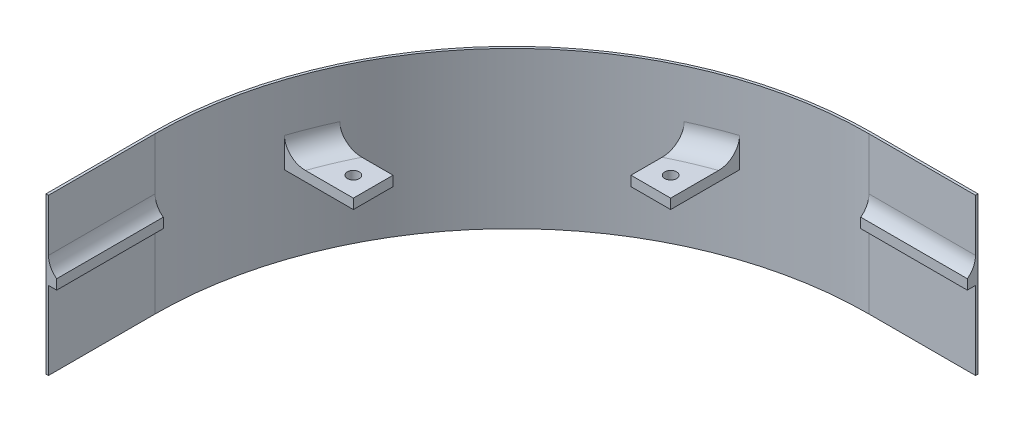
from build123d import *

# Parameters (mm, degrees)
BOSS_EXTRUDE1_DEPTH      = 6.35
CUT_EXTRUDE1_DEPTH       = 6.35
M4_CLEARANCE_HOLE1_D     = 4.5
F_6_CLEARANCE_HOLE1_D    = 3.7973
F_6_CLEARANCE_HOLE2_D    = 3.7973
SKETCH29_R               = 1.898650000000008
BOSS_EXTRUDE4_DEPTH      = 3.175
CUT_EXTRUDE9_DEPTH       = 211.00951038732748
BOSS_EXTRUDE5_DEPTH      = 25
BOSS_EXTRUDE5_DEPTH_BACK = 25
BOSS_EXTRUDE6_DEPTH      = 3.420518063
SKETCH32_W               = 34.13124999999999
SKETCH32_H               = 3.175
BOSS_EXTRUDE7_DEPTH      = 3.420518063
FILLET2_R                = 6.35
FILLET3_R                = 6.35


with BuildPart() as part:
    # Sketch1 → Boss-Extrude1 (new body)
    with BuildSketch(Plane(origin=(0, 0, 0), x_dir=(1, 0, 0), z_dir=(0, 1, 0))):
        with BuildLine():
            Line((-34.13124999999996, -148.43124999999998), (34.131250000000016, -148.43124999999998))
            ThreePointArc((34.131250000000016, -148.43124999999998), (114.9535550896224, -114.95355508962234), (148.43124999999998, -34.13124999999996))
            Line((148.43124999999998, -34.13124999999996), (148.43124999999998, 34.131250000000016))
            ThreePointArc((148.43124999999998, 34.131250000000016), (114.9535550896224, 114.9535550896224), (34.131250000000016, 148.43125000000003))
            Line((34.131250000000016, 148.43125000000003), (-34.13124999999996, 148.43125000000003))
            ThreePointArc((-34.13124999999996, 148.43125000000003), (-114.95355508962231, 114.95355508962237), (-148.43124999999992, 34.131250000000016))
            Line((-148.43124999999992, 34.131250000000016), (-148.43124999999992, -34.13124999999996))
            ThreePointArc((-148.43124999999992, -34.13124999999996), (-114.95355508962234, -114.95355508962234), (-34.13124999999996, -148.43124999999998))
        make_face()
    extrude(amount=BOSS_EXTRUDE1_DEPTH)

    # Sketch4 → Cut-Extrude1 (cut)
    # profile 1 of 4: a face of its own
    with BuildSketch(Plane(origin=(0, 6.35, 0), x_dir=(1, 0, 0), z_dir=(0, 1, 0))):
        with BuildLine():
            ThreePointArc((-39.4480000000008, 145.80448193711538), (-49.893930566331434, 144.3300216659586), (-59.52363351317686, 140.0218527227403))
            ThreePointArc((-59.52363351317686, 140.0218527227403), (-63.81750000000949, 132.2535819370977), (-59.52363351317676, 124.48531115145514))
            ThreePointArc((-59.52363351317676, 124.48531115145514), (-49.89393056632884, 120.17714220824536), (-39.448000000000604, 118.70268193708908))
            Line((-39.448000000000604, 118.70268193708908), (39.44799999999939, 118.70268193708088))
            ThreePointArc((39.44799999999939, 118.70268193708088), (49.89393056633003, 120.17714220823765), (59.52363351317546, 124.48531115145597))
            ThreePointArc((59.52363351317546, 124.48531115145597), (63.817500000008096, 132.25358193709857), (59.523633513170694, 140.0218527227337))
            ThreePointArc((59.523633513170694, 140.0218527227337), (49.893930566325004, 144.3300216659425), (39.4479999999992, 145.80448193710717))
            Line((39.4479999999992, 145.80448193710717), (-39.4480000000008, 145.80448193711538))
        make_face()
        with BuildLine():
            ThreePointArc((39.447999999999375, 120.29018193708089), (49.454528647108134, 121.70261990502122), (58.67916380898574, 125.82956825808905))
            ThreePointArc((58.67916380898574, 125.82956825808905), (62.229999999999336, 132.25358193709857), (58.67916380898565, 138.67759561610805))
            ThreePointArc((58.67916380898565, 138.67759561610805), (49.45452864710313, 142.80454396915894), (39.447999999999205, 144.21698193711595))
            Line((39.447999999999205, 144.21698193711595), (-39.44800000000079, 144.21698193711538))
            ThreePointArc((-39.44800000000079, 144.21698193711538), (-49.454528647109534, 142.80454396917506), (-58.67916380898715, 138.67759561610723))
            ThreePointArc((-58.67916380898715, 138.67759561610723), (-62.23000000000073, 132.25358193709772), (-58.67916380898706, 125.82956825808822))
            ThreePointArc((-58.67916380898706, 125.82956825808822), (-49.454528647104546, 121.70261990503734), (-39.44800000000062, 120.29018193708033))
            Line((-39.44800000000062, 120.29018193708033), (39.447999999999375, 120.29018193708089))
        make_face(mode=Mode.SUBTRACT)
    # profile 2 of 4: a face of its own
    with BuildSketch(Plane(origin=(0, 6.35, 0), x_dir=(1, 0, 0), z_dir=(0, 1, 0))):
        with BuildLine():
            Line((-39.44800000000062, 120.29018193708033), (39.447999999999375, 120.29018193708089))
            ThreePointArc((39.447999999999375, 120.29018193708089), (49.454528647108134, 121.70261990502122), (58.67916380898574, 125.82956825808905))
            ThreePointArc((58.67916380898574, 125.82956825808905), (62.229999999999336, 132.25358193709857), (58.67916380898565, 138.67759561610805))
            ThreePointArc((58.67916380898565, 138.67759561610805), (49.45452864710313, 142.80454396915894), (39.447999999999205, 144.21698193711595))
            Line((39.447999999999205, 144.21698193711595), (-39.44800000000079, 144.21698193711538))
            ThreePointArc((-39.44800000000079, 144.21698193711538), (-49.454528647109534, 142.80454396917506), (-58.67916380898715, 138.67759561610723))
            ThreePointArc((-58.67916380898715, 138.67759561610723), (-62.23000000000073, 132.25358193709772), (-58.67916380898706, 125.82956825808822))
            ThreePointArc((-58.67916380898706, 125.82956825808822), (-49.454528647104546, 121.70261990503734), (-39.44800000000062, 120.29018193708033))
        make_face()
    # profile 3 of 4: a face of its own
    with BuildSketch(Plane(origin=(0, 6.35, 0), x_dir=(1, 0, 0), z_dir=(0, 1, 0))):
        with BuildLine():
            ThreePointArc((-59.5236335131764, -124.48531115145636), (-63.8175000000091, -132.25358193709894), (-59.52363351317174, -140.02185272273414))
            ThreePointArc((-59.52363351317174, -140.02185272273414), (-49.893930566326084, -144.33002166594298), (-39.44800000000029, -145.80448193711646))
            Line((-39.44800000000029, -145.80448193711646), (39.44799999999971, -145.80448193711646))
            ThreePointArc((39.44799999999971, -145.80448193711646), (49.89393056633035, -144.33002166595978), (59.52363351317579, -140.02185272274153))
            ThreePointArc((59.52363351317579, -140.02185272274153), (63.8175000000085, -132.25358193709894), (59.52363351317116, -124.48531115146376))
            ThreePointArc((59.52363351317116, -124.48531115146376), (49.89393056632551, -120.1771422082549), (39.44799999999971, -118.70268193709018))
            Line((39.44799999999971, -118.70268193709018), (-39.44800000000029, -118.70268193708142))
            ThreePointArc((-39.44800000000029, -118.70268193708142), (-49.89393056633094, -120.17714220823811), (-59.5236335131764, -124.48531115145636))
        make_face()
        with BuildLine():
            ThreePointArc((-58.679163808986694, -138.67759561610845), (-49.454528647104205, -142.8045439691594), (-39.44800000000029, -144.21698193711646))
            Line((-39.44800000000029, -144.21698193711646), (39.44799999999971, -144.21698193711646))
            ThreePointArc((39.44799999999971, -144.21698193711646), (49.45452864710846, -142.8045439691762), (58.679163808986104, -138.67759561610845))
            ThreePointArc((58.679163808986104, -138.67759561610845), (62.22999999999976, -132.25358193709894), (58.679163808986104, -125.82956825808944))
            ThreePointArc((58.679163808986104, -125.82956825808944), (49.45452864710362, -121.7026199050385), (39.44799999999971, -120.29018193708143))
            Line((39.44799999999971, -120.29018193708143), (-39.44800000000029, -120.29018193708143))
            ThreePointArc((-39.44800000000029, -120.29018193708143), (-49.45452864710904, -121.70261990502169), (-58.679163808986694, -125.82956825808944))
            ThreePointArc((-58.679163808986694, -125.82956825808944), (-62.230000000000345, -132.25358193709894), (-58.679163808986694, -138.67759561610845))
        make_face(mode=Mode.SUBTRACT)
    # profile 4 of 4: a face of its own
    with BuildSketch(Plane(origin=(0, 6.35, 0), x_dir=(1, 0, 0), z_dir=(0, 1, 0))):
        with BuildLine():
            ThreePointArc((-58.679163808986694, -125.82956825808944), (-62.230000000000345, -132.25358193709894), (-58.679163808986694, -138.67759561610845))
            ThreePointArc((-58.679163808986694, -138.67759561610845), (-49.454528647104205, -142.8045439691594), (-39.44800000000029, -144.21698193711646))
            Line((-39.44800000000029, -144.21698193711646), (39.44799999999971, -144.21698193711646))
            ThreePointArc((39.44799999999971, -144.21698193711646), (49.45452864710846, -142.8045439691762), (58.679163808986104, -138.67759561610845))
            ThreePointArc((58.679163808986104, -138.67759561610845), (62.22999999999976, -132.25358193709894), (58.679163808986104, -125.82956825808944))
            ThreePointArc((58.679163808986104, -125.82956825808944), (49.45452864710362, -121.7026199050385), (39.44799999999971, -120.29018193708143))
            Line((39.44799999999971, -120.29018193708143), (-39.44800000000029, -120.29018193708143))
            ThreePointArc((-39.44800000000029, -120.29018193708143), (-49.45452864710904, -121.70261990502169), (-58.679163808986694, -125.82956825808944))
        make_face()
    extrude(amount=-CUT_EXTRUDE1_DEPTH, mode=Mode.SUBTRACT)

    # M4 Clearance Hole1 (through all)
    with Locations(Plane(origin=(0, 6.35, 0), x_dir=(1, 0, 0), z_dir=(0, 1, 0))):
        with Locations((-16, -103.6875), (16, -103.6875), (22, -60.325), (-10, -60.325), (-10, 60.325), (22, 60.325), (16, 103.6875), (-16, 103.6875)):
            Hole(M4_CLEARANCE_HOLE1_D / 2)

    # #6 Clearance Hole1 (through all)
    with Locations(Plane(origin=(0, 6.35, 0), x_dir=(1, 0, 0), z_dir=(0, 1, 0))):
        with Locations((-101.6, -101.6), (-101.6, 101.6), (101.6, 101.6), (101.6, -101.6), (-127, -76.2), (-127, -50.8), (-127, 50.8), (-127, 76.2), (-101.6, 76.2), (-101.6, 50.8), (-101.6, 25.4), (-101.6, 0), (-101.6, -25.4), (-101.6, -50.8), (-101.6, -76.2), (-76.2, -101.6), (-50.8, -101.6), (-50.8, -76.2), (-76.2, -76.2), (-76.2, -50.8), (-50.8, -50.8), (-50.8, -25.4), (-76.2, -25.4), (-76.2, 0), (-50.8, 0), (-50.8, 25.4), (-76.2, 25.4), (-76.2, 50.8), (-50.8, 50.8), (-50.8, 76.2), (-76.2, 76.2), (-76.2, 101.6), (-50.8, 101.6), (50.8, -101.6), (76.2, -101.6), (101.6, -76.2), (127, -76.2), (127, -50.8), (101.6, -25.4), (101.6, -50.8), (76.2, -25.4), (76.2, -50.8), (76.2, -76.2), (50.8, -76.2), (50.8, -50.8), (50.8, -25.4), (50.8, 0), (76.2, 0), (101.6, 0), (101.6, 25.4), (101.6, 50.8), (101.6, 76.2), (127, 50.8), (127, 76.2), (76.2, 101.6), (50.8, 101.6), (50.8, 76.2), (76.2, 76.2), (76.2, 50.8), (76.2, 25.4), (50.8, 25.4), (50.8, 50.8), (0, 0), (-25.4, -25.4), (-25.4, 0), (-25.4, 25.4), (0, 25.4), (25.4, 25.4), (25.4, 0), (25.4, -25.4), (0, -25.4), (127, -25.4), (127, 0), (127, 25.4), (-127, -25.4), (-127, 0), (-127, 25.4)):
            Hole(F_6_CLEARANCE_HOLE1_D / 2)

    # #6 Clearance Hole2 (through all)
    with Locations(Plane(origin=(0, 6.35, 0), x_dir=(1, 0, 0), z_dir=(0, 1, 0))):
        with Locations((-76.2, -127), (76.2, -127), (76.2, 127), (-76.2, 127)):
            Hole(F_6_CLEARANCE_HOLE2_D / 2)

    # Sketch29 → Boss-Extrude4 (add)
    # profile 1 of 4: a face of its own
    with BuildSketch(Plane(origin=(0, 6.35, 0), x_dir=(1, 0, 0), z_dir=(0, 1, 0))):
        with BuildLine():
            Line((-69.85, 120.64999999999999), (-69.85, 142.70684992207043))
            ThreePointArc((-69.85, 142.70684992207043), (-76.27533753088031, 140.3779717667891), (-82.55, 137.66923649982286))
            Line((-82.55, 137.6692364998229), (-82.54999999999998, 120.64999999999999))
            Line((-82.54999999999998, 120.64999999999999), (-69.85, 120.64999999999999))
        make_face()
        with Locations(Location((-76.19999999999999, 127, 0), (0, 0, 270))):
            Circle(SKETCH29_R, mode=Mode.SUBTRACT)
    # profile 2 of 4: a face of its own
    with BuildSketch(Plane(origin=(0, 6.35, 0), x_dir=(1, 0, 0), z_dir=(0, 1, 0))):
        with BuildLine():
            Line((-120.6500000000006, 82.54999999999993), (-137.6692364998229, 82.54999999999993))
            ThreePointArc((-137.66923649982286, 82.5499999999999), (-140.37797176678907, 76.27533753088025), (-142.70684992207038, 69.84999999999994))
            Line((-142.70684992207043, 69.84999999999994), (-120.6500000000006, 69.84999999999994))
            Line((-120.6500000000006, 69.84999999999994), (-120.6500000000006, 82.54999999999993))
        make_face()
        with Locations(Location((-127.00000000000061, 76.19999999999993, 0), (0, 0, 270))):
            Circle(SKETCH29_R, mode=Mode.SUBTRACT)
    # profile 3 of 4: a face of its own
    with BuildSketch(Plane(origin=(0, 6.35, 0), x_dir=(1, 0, 0), z_dir=(0, 1, 0))):
        Polygon((-145.8044819371153, 34.13124999999998), (-145.8044819371153, 0), (-148.43124999999995, 2.082e-14), (-148.43124999999995, 34.131249999999994), align=None)
    # profile 4 of 4: a face of its own
    with BuildSketch(Plane(origin=(0, 6.35, 0), x_dir=(1, 0, 0), z_dir=(0, 1, 0))):
        Polygon((2.776e-14, 148.43125), (0, 145.80448193711538), (-34.13124999999999, 145.80448193711538), (-34.13124999999996, 148.43125000000003), align=None)
    extrude(amount=BOSS_EXTRUDE4_DEPTH)

    # Sketch30 → Cut-Extrude9 (cut, through all)
    with BuildSketch(Plane(origin=(0, 6.35, 0), x_dir=(1, 0, 0), z_dir=(0, 1, 0))):
        with BuildLine():
            Line((-34.13124999999998, -148.43124999999995), (34.131250000000016, -148.43124999999998))
            ThreePointArc((34.131250000000016, -148.43124999999998), (114.9535550896224, -114.95355508962234), (148.43125, -34.13124999999996))
            Line((148.43125, -34.13124999999996), (148.43124999999998, 34.131250000000016))
            ThreePointArc((148.43124999999998, 34.131250000000016), (114.95355508962237, 114.95355508962237), (34.13125000000002, 148.43125))
            Line((34.13125000000002, 148.43125), (-34.13124999999996, 148.43125000000003))
            ThreePointArc((-34.13124999999996, 148.43125000000003), (-114.95355508962234, 114.9535550896224), (-148.43124999999995, 34.13125000000003))
            Line((-148.43124999999995, 34.13125000000003), (-148.43124999999995, -34.131249999999945))
            ThreePointArc((-148.43124999999995, -34.131249999999945), (-114.95355508962234, -114.95355508962231), (-34.13124999999998, -148.43124999999995))
        make_face()
    extrude(amount=-CUT_EXTRUDE9_DEPTH, mode=Mode.SUBTRACT)


with BuildPart() as cut_extrude9_piece_1:
    # of the separate pieces the step leaves, piece 1, a body of its own (cut_extrude9_pieces)
    add(part.part.solids().sort_by_distance((-82.55, 6.35, -137.6692365))[0])



with BuildPart() as cut_extrude9_piece_2:
    # of the separate pieces the step leaves, piece 2, a body of its own (cut_extrude9_pieces)
    add(part.part.solids().sort_by_distance((-142.706849922, 6.35, -69.85))[0])


with BuildPart() as cut_extrude9_piece_3:
    # of the separate pieces the step leaves, piece 3, a body of its own (cut_extrude9_pieces)
    add(part.part.solids().sort_by_distance((-148.43125, 6.35, -34.13125))[0])


with BuildPart() as cut_extrude9_piece_4:
    # of the separate pieces the step leaves, piece 4, a body of its own (cut_extrude9_pieces)
    add(part.part.solids().sort_by_distance((-34.13125, 6.35, -145.804481937))[0])


with BuildPart() as cut_extrude9_piece_1_1:
    add(cut_extrude9_piece_1.part)

    add(cut_extrude9_piece_2.part)  # Boss-Extrude5 merges Cut-Extrude9 piece 2
    # Sketch29<7> → Boss-Extrude5 (add, two sides: drawn at the far end of the back side and taken through both)
    with BuildSketch(Plane(origin=(0, 6.35, 0), x_dir=(1, 0, 0), z_dir=(0, 1, 0)).offset(-BOSS_EXTRUDE5_DEPTH_BACK)):
        with BuildLine():
            ThreePointArc((-69.85, 142.70684992207043), (-52.21852354947877, 146.99107693388436), (-34.13124999999996, 148.43125000000003))
            Line((-34.13124999999996, 148.43125000000003), (2.842e-14, 148.43125))
            Line((2.776e-14, 148.43125), (2.776e-14, 149.22500000000002))
            Line((2.776e-14, 149.22500000000002), (-34.13124999999996, 149.22500000000002))
            ThreePointArc((-34.13124999999995, 149.22500000000002), (-115.51482109718914, 115.51482109718923), (-149.22499999999997, 34.13125000000003))
            Line((-149.22499999999997, 34.131249999999994), (-149.22499999999997, 2.132e-14))
            Line((-149.22499999999997, 2.082e-14), (-148.43124999999995, 2.082e-14))
            Line((-148.43124999999995, 2.132e-14), (-148.43124999999995, 34.131249999999994))
            ThreePointArc((-148.43124999999995, 34.13125000000001), (-146.9910769338843, 52.218523549478746), (-142.70684992207038, 69.84999999999994))
            ThreePointArc((-142.70684992207038, 69.84999999999994), (-140.37797176678907, 76.27533753088025), (-137.66923649982286, 82.5499999999999))
            ThreePointArc((-137.6692364998229, 82.54999999999994), (-114.9535550896224, 114.95355508962237), (-82.55000000000001, 137.66923649982292))
            ThreePointArc((-82.55, 137.66923649982286), (-76.27533753088031, 140.3779717667891), (-69.85, 142.70684992207043))
        make_face()
    extrude(amount=BOSS_EXTRUDE5_DEPTH + BOSS_EXTRUDE5_DEPTH_BACK)


    add(cut_extrude9_piece_3.part)  # Boss-Extrude6 merges Cut-Extrude9 piece 3
    # Sketch31 → Boss-Extrude6 (add)
    with BuildSketch(Plane(origin=(-145.8044819371153, 0, 0), x_dir=(0, 0, -1), z_dir=(1, 0, 0))):
        Polygon((1.15561e-12, 6.35), (34.13124999999998, 6.35), (34.13124999999998, 9.524999999999999), (1.15548e-12, 9.524999999999999), align=None)
    extrude(amount=-BOSS_EXTRUDE6_DEPTH)


    add(cut_extrude9_piece_4.part)  # Boss-Extrude7 merges Cut-Extrude9 piece 4
    # Sketch32 → Boss-Extrude7 (add)
    with BuildSketch(Plane.XY.offset(-145.80448193711126)):
        with Locations((-17.065625000015128, 7.937499999999998)):
            Rectangle(SKETCH32_W, SKETCH32_H)
    extrude(amount=-BOSS_EXTRUDE7_DEPTH)

    # Fillet2
    fillet2_edges = [cut_extrude9_piece_1_1.edges().sort_by_distance(p)[0] for p in [
        (-76.27533753088031, 9.524999999999999, -140.3779717667891),
        (-140.37797176678907, 9.524999999999999, -76.27533753088022),
    ]]
    fillet(fillet2_edges, radius=FILLET2_R)

    # Fillet3
    # the kernel refuses this fillet: 6.35 mm, written as the material it adds along each edge
    with BuildSketch(Plane(origin=(-34.13124999999996, 9.524999999999999, -148.43125000000003), x_dir=(0, 1, 0), z_dir=(1, 0, 8.3e-16))) as fillet3_piece_1:
        with BuildLine():
            CenterArc((5.143932731135228, 6.349999999999994), FILLET3_R, 215.89740993891724, 54.102590061082765)
            Line((0, 2.6267680628846506), (-0.10287865462270496, 2.5523034241423375))
            ThreePointArc((-0.10287865462270496, 2.5523034241423375), (-0.12700000000000067, 1.3133840314423253), (-0.12700000000000067, 0))
            Line((-0.12700000000000067, 0), (0, -0.12700000000000955))
            Line((0, -0.12700000000000955), (5.143932731135228, -0.12700000000000955))
            Line((5.143932731135228, -0.12700000000000955), (5.143932731135228, 0))
        make_face()
    extrude(amount=34.13124999999999)
    with BuildSketch(Plane(origin=(-148.43124999999995, 9.524999999999999, -2.082e-14), x_dir=(0, 1, 0), z_dir=(0, 0, -1))) as fillet3_piece_2:
        with BuildLine():
            CenterArc((5.143932731135228, 6.349999999999994), FILLET3_R, 215.89740993891724, 54.102590061082765)
            Line((0, 2.6267680628846506), (-0.10287865462270496, 2.5523034241423375))
            ThreePointArc((-0.10287865462270496, 2.5523034241423375), (-0.12700000000000067, 1.3133840314423253), (-0.12700000000000067, 0))
            Line((-0.12700000000000067, 0), (0, -0.12700000000000955))
            Line((0, -0.12700000000000955), (5.143932731135228, -0.12700000000000955))
            Line((5.143932731135228, -0.12700000000000955), (5.143932731135228, 0))
        make_face()
    extrude(amount=34.13124999999997)


solid = cut_extrude9_piece_1_1.part
